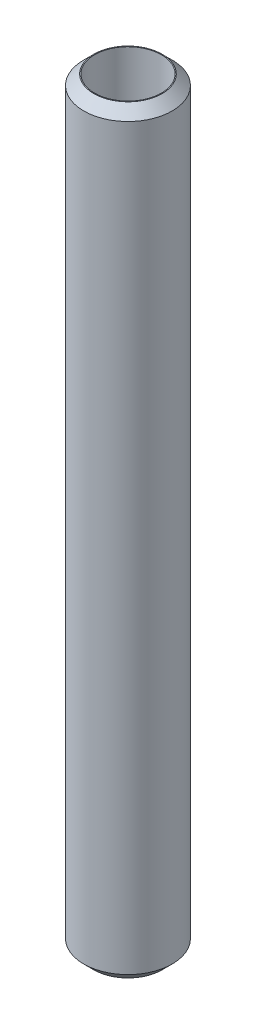
from build123d import *

# Parameters (mm, degrees)
SKETCH1_R           = 25
BOSS_EXTRUDE1_DEPTH = 429.279112159
SKETCH2_R           = 18.856935319
CUT_EXTRUDE1_DEPTH  = 431.732580769
CHAMFER1_SIZE       = 5.654873437


with BuildPart() as part:
    # Sketch1 → Boss-Extrude1 (new body)
    with BuildSketch(Plane(origin=(0, 0, 0), x_dir=(1, 0, 0), z_dir=(0, 1, 0))):
        Circle(SKETCH1_R)
    extrude(amount=BOSS_EXTRUDE1_DEPTH)

    # Sketch2 → Cut-Extrude1 (cut, through all)
    with BuildSketch(Plane(origin=(0, 0, 0), x_dir=(1, 0, 0), z_dir=(0, 1, 0))):
        Circle(SKETCH2_R)
    extrude(amount=CUT_EXTRUDE1_DEPTH, mode=Mode.SUBTRACT)

    # Chamfer1
    chamfer1_edges = [part.edges().sort_by_distance(p)[0] for p in [
        (-25, 429.279112159, 0),
        (-25, 0, 0),
    ]]
    chamfer(chamfer1_edges, length=CHAMFER1_SIZE)


solid = part.part
